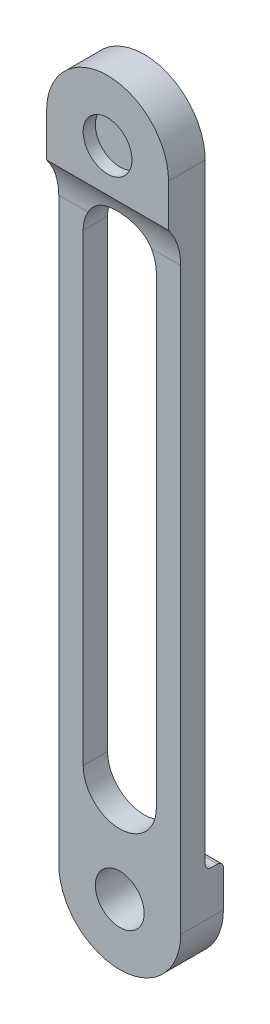
from build123d import *

# Parameters (mm, degrees)
CROQUIS1_R              = 4
SALIENTE_EXTRUIR1_DEPTH = 4
SALIENTE_EXTRUIR2_START = -3
CROQUIS1_5_R            = 4
SALIENTE_EXTRUIR2_DEPTH = 3
REDONDEO2_R             = 1
CROQUIS1_6_R            = 4
SALIENTE_EXTRUIR3_DEPTH = 6
REDONDEO1_R             = 10


with BuildPart() as part:
    # Croquis1 → Saliente-Extruir1 (new body)
    with BuildSketch(Plane.XY):
        with BuildLine():
            Line((10, 54), (10, -54))
            ThreePointArc((10, -54), (0, -64), (-10, -54))
            Line((-10, -54), (-10, 54))
            ThreePointArc((-10, 54), (0, 64), (10, 54))
        make_face()
        with Locations((0, -54)):
            Circle(CROQUIS1_R, mode=Mode.SUBTRACT)
        with BuildLine():
            Line((6, 38), (6, -38))
            ThreePointArc((6, -38), (0, -44), (-6, -38))
            Line((-6, -38), (-6, 38))
            ThreePointArc((-6, 38), (0, 44), (6, 38))
        make_face(mode=Mode.SUBTRACT)
    extrude(amount=SALIENTE_EXTRUIR1_DEPTH)

    # Croquis1<5> → Saliente-Extruir2 (add)
    with BuildSketch(Plane.XY.offset(SALIENTE_EXTRUIR2_START)):
        with BuildLine():
            Line((10, -54), (10, -47))
            Line((10, -47), (-10, -47))
            Line((-10, -47), (-10, -54))
            ThreePointArc((-10, -54), (0, -64), (10, -54))
        make_face()
        with Locations((0, -54)):
            Circle(CROQUIS1_5_R, mode=Mode.SUBTRACT)
    extrude(amount=SALIENTE_EXTRUIR2_DEPTH)

    # Redondeo2
    redondeo2_edges = [part.edges().sort_by_distance(p)[0] for p in [
        (0, -47, 0),
        (0, -47, -3),
    ]]
    fillet(redondeo2_edges, radius=REDONDEO2_R)

    # Croquis1<6> → Saliente-Extruir3 (add)
    with BuildSketch(Plane.XY):
        with BuildLine():
            Line((10, 47), (10, 54))
            ThreePointArc((10, 54), (0, 64), (-10, 54))
            Line((-10, 54), (-10, 47))
            Line((-10, 47), (10, 47))
        make_face()
        with Locations((0, 54)):
            Circle(CROQUIS1_6_R, mode=Mode.SUBTRACT)
    extrude(amount=SALIENTE_EXTRUIR3_DEPTH)

    # Redondeo1
    # the kernel refuses this fillet: 10 mm, written as the material it adds along each edge
    with BuildSketch(Plane(origin=(-10, 47, 4), x_dir=(0, 0, 1), z_dir=(1, 0, 0))) as redondeo1_piece_1_section:
        with BuildLine():
            CenterArc((10, 6), REDONDEO1_R, 180, 36.869897646)
            Line((0, 6), (-0.2, 6))
            Line((-0.2, 6), (-0.2, 0))
            Line((-0.2, 0), (0, -0.2))
            ThreePointArc((0, -0.2), (1, -0.2), (1.84, -0.12))
            Line((1.84, -0.12), (2, 0))
        make_face()
    redondeo1_piece_1 = extrude(amount=20, mode=Mode.PRIVATE)
    redondeo1_piece_1 = redondeo1_piece_1 - Plane(origin=(0, 38, 4.484524187), x_dir=(-1, 0, 0), z_dir=(0, 0, -1)) * Cylinder(6, 65, mode=Mode.PRIVATE)
    add(redondeo1_piece_1)


solid = part.part
